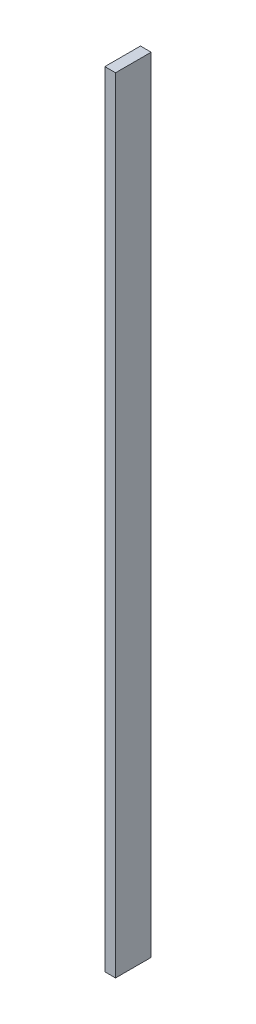
from build123d import *

# Parameters (mm, degrees)
SKIZZE1_W                       = 3
SKIZZE1_H                       = 10
AUFSATZ_LINEAR_AUSTRAGEN1_DEPTH = 219.8


with BuildPart() as part:
    # Skizze1 → Aufsatz-Linear austragen1 (new body)
    with BuildSketch(Plane(origin=(0, 0, 0), x_dir=(1, 0, 0), z_dir=(0, 1, 0))):
        Rectangle(SKIZZE1_W, SKIZZE1_H)
    extrude(amount=AUFSATZ_LINEAR_AUSTRAGEN1_DEPTH)


solid = part.part
